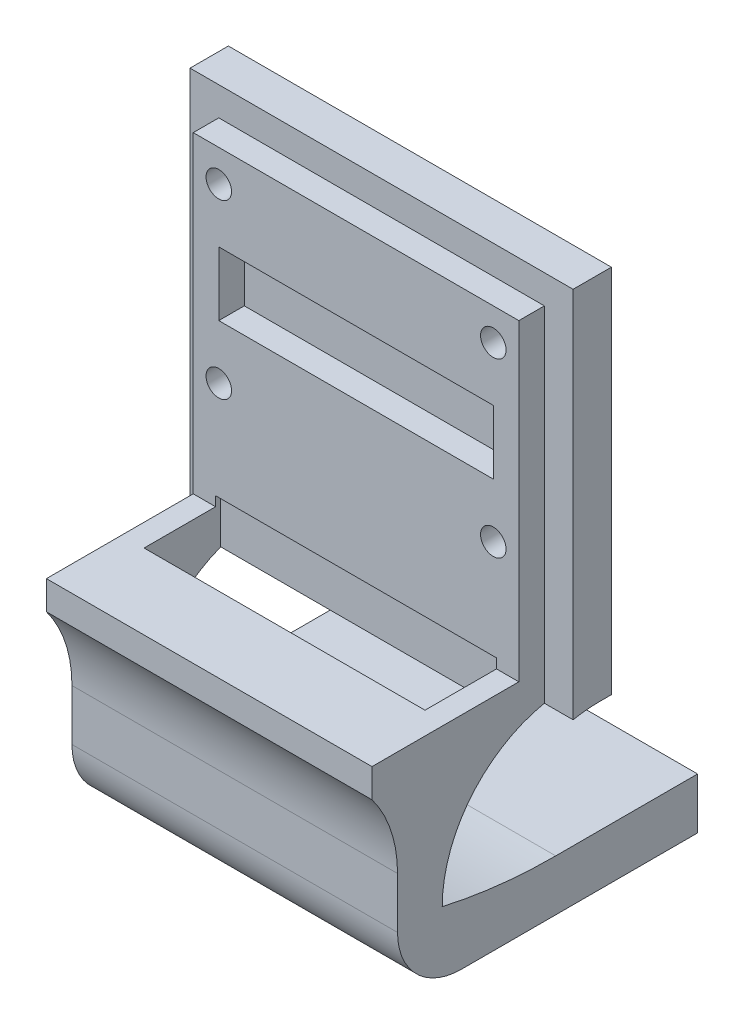
from build123d import *

# Parameters (mm, degrees)
CROQUIS3_W              = 30
CROQUIS3_H              = 29
SALIENTE_EXTRUIR1_DEPTH = 5
CROQUIS5_W              = 30
CROQUIS5_H              = 29
CROQUIS5_W_2            = 25.5
CROQUIS5_H_2            = 24.5
CORTAR_EXTRUIR1_DEPTH   = 2
CROQUIS9_W              = 25.5
CROQUIS9_H              = 2.25
SALIENTE_EXTRUIR2_DEPTH = 13.5
CROQUIS11_W             = 22
CROQUIS11_H             = 6
CORTAR_EXTRUIR3_DEPTH   = 3
CROQUIS12_W             = 25.5
CROQUIS12_H             = 3.5
SALIENTE_EXTRUIR3_DEPTH = 15
CROQUIS13_W             = 25.5
CROQUIS13_H             = 4
SALIENTE_EXTRUIR4_DEPTH = 20
REDONDEO3_R             = 5
CROQUIS14_R             = 1.5
CORTAR_EXTRUIR4_DEPTH   = 7
REDONDEO5_R             = 10
REDONDEO6_R             = 40
CROQUIS6_R              = 1
CORTAR_EXTRUIR5_DEPTH   = 5
CORTAR_EXTRUIR7_DEPTH   = 2
CROQUIS16_W             = 21.5
CROQUIS16_H             = 5
CORTAR_EXTRUIR8_DEPTH   = 2


with BuildPart() as part:
    # Croquis3 → Saliente-Extruir1 (new body)
    with BuildSketch(Plane.XY):
        Rectangle(CROQUIS3_W, CROQUIS3_H)
    extrude(amount=SALIENTE_EXTRUIR1_DEPTH)

    # Croquis5 → Cortar-Extruir1 (cut)
    with BuildSketch(Plane.XY.offset(5)):
        Rectangle(CROQUIS5_W, CROQUIS5_H)
        Rectangle(CROQUIS5_W_2, CROQUIS5_H_2, mode=Mode.SUBTRACT)
    extrude(amount=-CORTAR_EXTRUIR1_DEPTH, mode=Mode.SUBTRACT)

    # Croquis9 → Saliente-Extruir2 (add)
    with BuildSketch(Plane.XY.offset(3)):
        with Locations((0, -13.375)):
            Rectangle(CROQUIS9_W, CROQUIS9_H)
    extrude(amount=SALIENTE_EXTRUIR2_DEPTH)

    # Croquis11 → Cortar-Extruir3 (cut)
    with BuildSketch(Plane.XZ.offset(14.5)):
        with Locations((0, 7.6)):
            Rectangle(CROQUIS11_W, CROQUIS11_H)
    extrude(amount=-CORTAR_EXTRUIR3_DEPTH, mode=Mode.SUBTRACT)

    # Croquis12 → Saliente-Extruir3 (add)
    with BuildSketch(Plane.XZ.offset(14.5)):
        with Locations((0, 12.75)):
            Rectangle(CROQUIS12_W, CROQUIS12_H)
    extrude(amount=SALIENTE_EXTRUIR3_DEPTH)

    # Croquis13 → Saliente-Extruir4 (add)
    with BuildSketch(Plane(origin=(0, 0, 11), x_dir=(-1, 0, 0), z_dir=(0, 0, -1))):
        with Locations((0, -27.5)):
            Rectangle(CROQUIS13_W, CROQUIS13_H)
    extrude(amount=SALIENTE_EXTRUIR4_DEPTH)

    # Redondeo3
    redondeo3_edges = [part.edges().sort_by_distance(p)[0] for p in [
        (0, -29.5, 14.5),
    ]]
    fillet(redondeo3_edges, radius=REDONDEO3_R)

    # Croquis14 → Cortar-Extruir4 (cut)
    with BuildSketch(Plane.XZ.offset(29.5)):
        with Locations((0, -3)):
            Circle(CROQUIS14_R)
    extrude(amount=-CORTAR_EXTRUIR4_DEPTH, mode=Mode.SUBTRACT)

    # Redondeo5
    # the kernel refuses this fillet: 10 mm, written as the material it adds along each edge
    with BuildSketch(Plane(origin=(12.75, -14.5, 11), x_dir=(0, -1, 0), z_dir=(-1, 0, 0))) as redondeo5_piece_1_section:
        with BuildLine():
            CenterArc((REDONDEO5_R, -REDONDEO5_R), REDONDEO5_R, 90, 90)
            Line((0, -REDONDEO5_R), (0, 0))
            Line((0, 0), (REDONDEO5_R, 0))
        make_face()
    redondeo5_piece_1 = extrude(amount=50.5, mode=Mode.PRIVATE)
    redondeo5_piece_1 = split(redondeo5_piece_1, bisect_by=Plane(origin=(11, -14.5, 11), z_dir=(1, 0, 0)), keep=Keep.TOP, mode=Mode.PRIVATE)
    add(redondeo5_piece_1)
    with BuildSketch(Plane(origin=(37.75, -14.5, 11), x_dir=(0, -1, 0), z_dir=(-1, 0, 0))) as redondeo5_piece_2_section:
        with BuildLine():
            CenterArc((REDONDEO5_R, -REDONDEO5_R), REDONDEO5_R, 90, 90)
            Line((0, -REDONDEO5_R), (0, 0))
            Line((0, 0), (REDONDEO5_R, 0))
        make_face()
    redondeo5_piece_2 = extrude(amount=50.5, mode=Mode.PRIVATE)
    redondeo5_piece_2 = split(redondeo5_piece_2, bisect_by=Plane(origin=(11, -14.5, 11), z_dir=(-1, 0, 0)), keep=Keep.TOP, mode=Mode.PRIVATE)
    redondeo5_piece_2 = split(redondeo5_piece_2, bisect_by=Plane(origin=(37.75, -14.5, 10.6), z_dir=(0, 0, 1)), keep=Keep.TOP, mode=Mode.PRIVATE)
    add(redondeo5_piece_2)
    with BuildSketch(Plane(origin=(37.75, -14.5, 11), x_dir=(0, -1, 0), z_dir=(-1, 0, 0))) as redondeo5_piece_3_section:
        with BuildLine():
            CenterArc((REDONDEO5_R, -REDONDEO5_R), REDONDEO5_R, 90, 90)
            Line((0, -REDONDEO5_R), (0, 0))
            Line((0, 0), (REDONDEO5_R, 0))
        make_face()
    redondeo5_piece_3 = extrude(amount=75.5, mode=Mode.PRIVATE)
    redondeo5_piece_3 = split(redondeo5_piece_3, bisect_by=Plane(origin=(37.75, -14.5, 3), z_dir=(0, 0, -1)), keep=Keep.TOP, mode=Mode.PRIVATE)
    redondeo5_piece_3 = split(redondeo5_piece_3, bisect_by=Plane(origin=(15, -14.5, 11), z_dir=(-1, 0, 0)), keep=Keep.TOP, mode=Mode.PRIVATE)
    redondeo5_piece_3 = split(redondeo5_piece_3, bisect_by=Plane(origin=(-15, -14.5, 11), z_dir=(1, 0, 0)), keep=Keep.TOP, mode=Mode.PRIVATE)
    add(redondeo5_piece_3)
    with BuildSketch(Plane(origin=(37.75, -14.5, 11), x_dir=(0, -1, 0), z_dir=(-1, 0, 0))) as redondeo5_piece_4_section:
        with BuildLine():
            CenterArc((REDONDEO5_R, -REDONDEO5_R), REDONDEO5_R, 90, 90)
            Line((0, -REDONDEO5_R), (0, 0))
            Line((0, 0), (REDONDEO5_R, 0))
        make_face()
    redondeo5_piece_4 = extrude(amount=50.5, mode=Mode.PRIVATE)
    redondeo5_piece_4 = split(redondeo5_piece_4, bisect_by=Plane(origin=(11, -14.5, 11), z_dir=(-1, 0, 0)), keep=Keep.TOP, mode=Mode.PRIVATE)
    redondeo5_piece_4 = split(redondeo5_piece_4, bisect_by=Plane(origin=(37.75, -14.5, 4.6), z_dir=(0, 0, -1)), keep=Keep.TOP, mode=Mode.PRIVATE)
    add(redondeo5_piece_4)
    with BuildSketch(Plane(origin=(37.75, -14.5, 11), x_dir=(0, -1, 0), z_dir=(-1, 0, 0))) as redondeo5_piece_5_section:
        with BuildLine():
            CenterArc((REDONDEO5_R, -REDONDEO5_R), REDONDEO5_R, 90, 90)
            Line((0, -REDONDEO5_R), (0, 0))
            Line((0, 0), (REDONDEO5_R, 0))
        make_face()
    redondeo5_piece_5 = extrude(amount=50.5, mode=Mode.PRIVATE)
    redondeo5_piece_5 = split(redondeo5_piece_5, bisect_by=Plane(origin=(-11, -14.5, 11), z_dir=(-1, 0, 0)), keep=Keep.TOP, mode=Mode.PRIVATE)
    add(redondeo5_piece_5)
    with BuildSketch(Plane(origin=(-12.75, -14.5, 14.5), x_dir=(0, -1, 0), z_dir=(1, 0, 0))) as redondeo5_piece_6:
        with BuildLine():
            CenterArc((6, -10), REDONDEO5_R, 90, 36.869897646)
            Line((0, -2), (0, 0))
            Line((0, 0), (6, 0))
        make_face()
    extrude(amount=25.5)

    # Redondeo6
    # the kernel refuses this fillet: 40 mm, written as the material it adds along each edge
    with BuildSketch(Plane(origin=(-12.75, -25.5, 11), x_dir=(0, 1, 0), z_dir=(1, 0, 0))) as redondeo6_piece_1:
        with BuildLine():
            CenterArc((40, -8.888194417), REDONDEO6_R, 167.161431859, 12.838568141)
            Line((0, -8.888194417), (-0.8, -8.888194417))
            Line((-0.8, -8.888194417), (-0.8, 0))
            Line((-0.8, 0), (0, 0.8))
            ThreePointArc((0, 0.8), (0.5, 0.8), (0.22, 0.177763888))
            Line((0.22, 0.177763888), (1, 0))
        make_face()
    extrude(amount=25.5)

    # Croquis6 → Cortar-Extruir5 (cut)
    with BuildSketch(Plane.XY):
        with Locations((-10.75, 9.75)):
            Circle(CROQUIS6_R)
        with Locations((-10.75, -3.75)):
            Circle(CROQUIS6_R)
        with Locations(Location((10.75, -3.75, 0), (0, 0, 180))):
            Circle(CROQUIS6_R)
        with Locations(Location((10.75, 9.75, 0), (0, 0, 180))):
            Circle(CROQUIS6_R)
    extrude(amount=CORTAR_EXTRUIR5_DEPTH, mode=Mode.SUBTRACT)

    # Croquis15 → Cortar-Extruir7 (cut)
    with BuildSketch(Plane(origin=(0, 0, 0), x_dir=(-1, 0, 0), z_dir=(0, 0, -1))):
        Polygon((-10.75, 12.636751346), (-13.25, 11.193375673), (-13.25, 8.306624327), (-10.75, 6.863248654), (-8.25, 8.306624327), (-8.25, 11.193375673), align=None)
        Polygon((10.75, 12.636751346), (8.25, 11.193375673), (8.25, 8.306624327), (10.75, 6.863248654), (13.25, 8.306624327), (13.25, 11.193375673), align=None)
        Polygon((10.75, -0.863248654), (8.25, -2.306624327), (8.25, -5.193375673), (10.75, -6.636751346), (13.25, -5.193375673), (13.25, -2.306624327), align=None)
        Polygon((-10.75, -0.863248654), (-13.25, -2.306624327), (-13.25, -5.193375673), (-10.75, -6.636751346), (-8.25, -5.193375673), (-8.25, -2.306624327), align=None)
    extrude(amount=-CORTAR_EXTRUIR7_DEPTH, mode=Mode.SUBTRACT)

    # Croquis16 → Cortar-Extruir8 (cut)
    with BuildSketch(Plane.XY.offset(5)):
        with Locations((0, 3)):
            Rectangle(CROQUIS16_W, CROQUIS16_H)
    extrude(amount=-CORTAR_EXTRUIR8_DEPTH, mode=Mode.SUBTRACT)


solid = part.part
